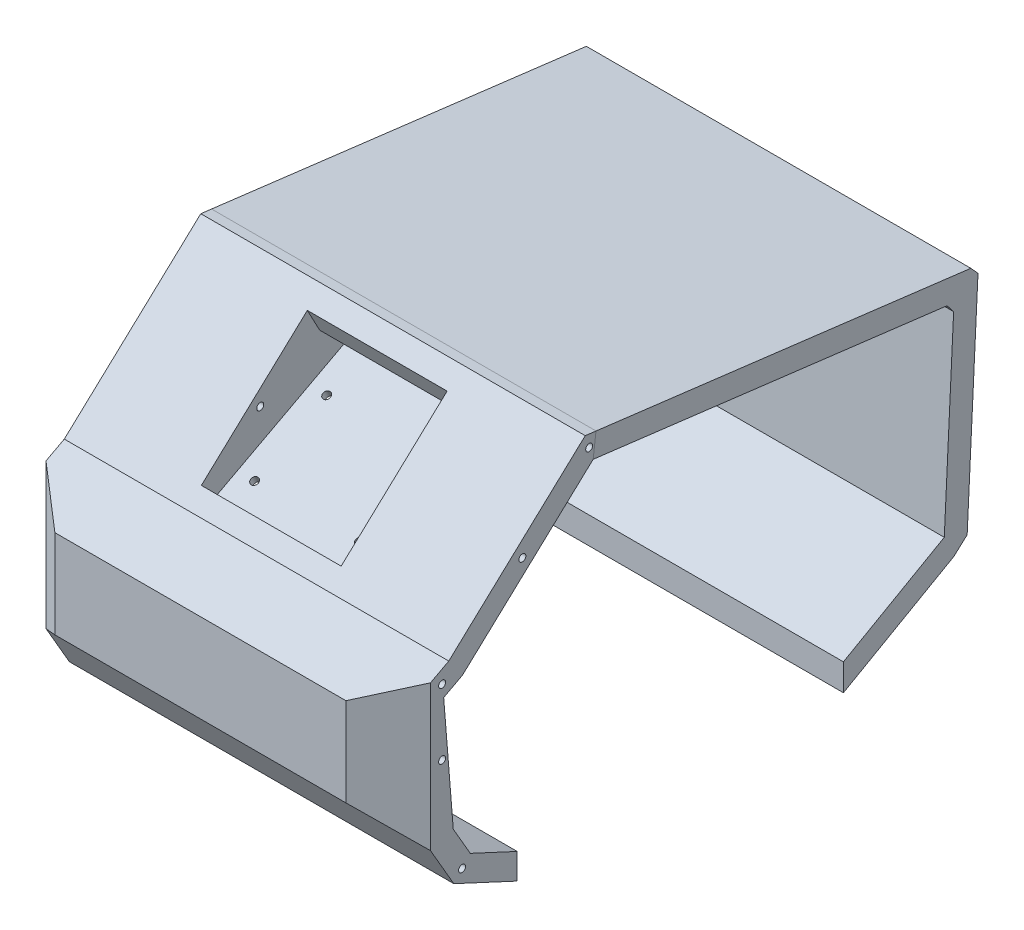
from build123d import *

# Parameters (mm, degrees)
EXTRUDE_1_DEPTH          = 165
CHAMFER_START            = -1
CHAMFER_2_DEPTH          = 167
CHAMFER_2_2_DEPTH        = 165
CHAMFER_3_SIZE           = 2
CHAMFER_3_SIZE2          = 6.502897882
EXTRUDE_2_DEPTH          = 165
CUT_EXTRUDE_1_DEPTH      = 129
CUT_EXTRUDE_1_DEPTH_BACK = 90
SKETCH_19_R              = 1.5
CUT_EXTRUDE_4_DEPTH      = 359
EXTRUDE_5_REACH          = 253.104
SKETCH_25_W              = 60
SKETCH_25_H              = 60
CUT_EXTRUDE_6_DEPTH      = 68
EXTRUDE_6_REACH          = 275.755
SKETCH_26_W              = 60
SKETCH_26_H              = 3
SKETCH_27_R              = 1.6
CUT_EXTRUDE_7_DEPTH      = 68
SKETCH_28_W              = 70
SKETCH_28_H              = 14
CUT_EXTRUDE_8_DEPTH      = 5
SKETCH_29_W              = 5
SKETCH_29_H              = 14
EXTRUDE_7_DEPTH          = 5


with BuildPart() as part:
    # 草图1 → 凸台-拉伸1 (new body)
    with BuildSketch(Plane(origin=(0, 0, 0), x_dir=(0, 0, -1), z_dir=(1, 0, 0))):
        Polygon((-119.14227599, 9.392327421), (-63.016495383, 61.600065372), (91.851255652, 42.389083929), (87.677118577, -42.733366558), (44.389827178, -67.355869721), (44.389827178, -78.860441079), (97.396076824, -48.709639137), (102.293876984, 51.170346614), (-66.413062293, 72.098046913), (-124.989193473, 17.611013079), (-137.666400315, 10.890640602), (-132.842708295, -48.915145032), (-122.817695194, -66.221187685), (-95.610172822, -78.860441079), (-95.610172822, -67.834078741), (-115.745111112, -58.48039399), (-123.056782297, -45.858356282), (-127.169844392, 5.136796181), align=None)
    extrude(amount=EXTRUDE_1_DEPTH)

    # 倒角2: read off the stored shape, not the designer's step
    # 倒角2 outline → 倒角2 (cut)
    with BuildSketch(Plane.YZ.offset(CHAMFER_START)):
        Polygon((51.170346614, -102.293876984), (51.570519841, -99.067913343), (48.173947041, -102.146942979), align=None)
    extrude(amount=CHAMFER_2_DEPTH, mode=Mode.SUBTRACT)

    # Chamfer 2 2 outline → Chamfer 2 2 (add)
    with BuildSketch(Plane.YZ):
        Polygon((42.389083929, -91.851255652), (42.758396287, -88.874074371), (39.142296059, -91.692043393), align=None)
    extrude(amount=CHAMFER_2_2_DEPTH)

    # 倒角3
    chamfer_3_edges = [part.edges().sort_by_distance(p)[0] for p in [
        (82.5, -48.709639137, -97.396076824),
    ]]
    chamfer_3_side = [part.faces().sort_by_distance(p)[0] for p in [
        (82.5, -0.267846048, -99.771509901),
    ]]
    chamfer(chamfer_3_edges, length=CHAMFER_3_SIZE, length2=CHAMFER_3_SIZE2, reference=chamfer_3_side[0])

    # 草图12 → 凸台-拉伸2 (add)
    with BuildSketch(Plane(origin=(165, 0, 0), x_dir=(0, 0, -1), z_dir=(1, 0, 0))):
        Polygon((-149.032892218, 4.865097255), (-149.032892218, -33.12186714), (-132.842708295, -48.915145032), (-137.666400315, 10.890640602), align=None)
    extrude(amount=-EXTRUDE_2_DEPTH)

    # 草图13 → 切除-拉伸1 (cut, two sides: drawn at the far end of the back side and taken through both)
    with BuildSketch(Plane.XZ.offset(-4.865097255).offset(-CUT_EXTRUDE_1_DEPTH_BACK)):
        Polygon((0, 149.032892218), (0, 132.842708295), (20, 149.032892218), align=None)
        Polygon((144.913186348, 149.032892218), (165, 149.032892218), (165, 132.842708295), align=None)
    extrude(amount=CUT_EXTRUDE_1_DEPTH + CUT_EXTRUDE_1_DEPTH_BACK, mode=Mode.SUBTRACT)


with BuildPart() as body_2:
    # Split Bodies 1: read off the stored shape, not the designer's step
    # Split Bodies 1: the piece on the far side of the plane
    add(part.part)
    split(bisect_by=Plane(origin=(0, 8.632109926, 69.587046078), x_dir=(1, 0, 0), z_dir=(0, 0.12310411940930002, 0.9923937604522012)), keep=Keep.BOTTOM)


with BuildPart() as part_1:
    add(part.part)

    # Split Bodies 1
    split(bisect_by=Plane(origin=(0, 8.632109926, 69.587046078), x_dir=(1, 0, 0), z_dir=(0, 0.12310411940930002, 0.9923937604522012)), keep=Keep.TOP)

    # 草图19 → 切除-拉伸4 (cut)
    with BuildSketch(Plane(origin=(165, 0, 0), x_dir=(0, 0, -1), z_dir=(1, 0, 0))):
        with Locations((-127.842708295, 10.4392122)):
            Circle(SKETCH_19_R)
        with Locations((-127.842708295, -17.733697424)):
            Circle(SKETCH_19_R)
        with Locations((-119.281403153, -62.350790838)):
            Circle(SKETCH_19_R)
        with Locations((-93.392718519, 40.173073312)):
            Circle(SKETCH_19_R)
        with Locations((-64.719702306, 66.844476373)):
            Circle(SKETCH_19_R)
    extrude(amount=-CUT_EXTRUDE_4_DEPTH, mode=Mode.SUBTRACT)

    # 凸台-拉伸5: up to this plane
    extrude_5_end = Plane(origin=(165, 64.450909172, 59.951703842), z_dir=(0, -0.7322016397474544, -0.6810879229226864))
    # 草图24 → 凸台-拉伸5 (add, up to the surface)
    with BuildSketch(Plane(origin=(0, 56.635574201, 30.023344955), x_dir=(1, 0, 0), z_dir=(0, 0.8835309997249798, 0.4683726855026645)), mode=Mode.PRIVATE) as extrude_5_sk1:
        Polygon((112.5, -50.383912681), (117.5, -48.140229484), (117.5, -28.846011859), (47.5, -28.846011859), (47.5, -79.551794233), (52.5, -77.308111036), (52.5, -33.846011859), (112.5, -33.846011859), align=None)
    extrude_5_tool1 = split(extrude(extrude_5_sk1.sketch, amount=EXTRUDE_5_REACH, mode=Mode.PRIVATE), bisect_by=extrude_5_end, keep=Keep.BOTH, mode=Mode.PRIVATE)
    add(extrude_5_tool1.solids().sort_by_distance((49.646128, 20.270483, 98.621891))[0])
    # 草图24 → 凸台-拉伸5 (add, up to the surface)
    with BuildSketch(Plane(origin=(0, 56.635574201, 30.023344955), x_dir=(1, 0, 0), z_dir=(0, 0.8835309997249798, 0.4683726855026645)), mode=Mode.PRIVATE) as extrude_5_sk2:
        Polygon((117.5, -98.846011859), (117.5, -48.140229484), (112.5, -50.383912681), (112.5, -93.846011859), (52.5, -93.846011859), (52.5, -77.308111036), (47.5, -79.551794233), (47.5, -98.846011859), align=None)
    extrude_5_tool2 = split(extrude(extrude_5_sk2.sketch, amount=EXTRUDE_5_REACH, mode=Mode.PRIVATE), bisect_by=extrude_5_end, keep=Keep.BOTH, mode=Mode.PRIVATE)
    add(extrude_5_tool2.solids().sort_by_distance((48.364354, 14.857244, 108.833341))[0])

    # 草图25 → 切除-拉伸6 (cut)
    with BuildSketch(Plane(origin=(0, 56.635574201, 30.023344955), x_dir=(-1, 0, 0), z_dir=(0, -0.8835309997249798, -0.46837268550266453))):
        with Locations((-82.5, -63.846011859)):
            Rectangle(SKETCH_25_W, SKETCH_25_H)
    extrude(amount=-CUT_EXTRUDE_6_DEPTH, mode=Mode.SUBTRACT)

    # 草图26 → 凸台-拉伸6 (add, up to next)
    with BuildSketch(Plane(origin=(0, -43.954908598, 82.915860678), x_dir=(-1, 0, 0), z_dir=(0, 0.4683726855026646, -0.8835309997249798)), mode=Mode.PRIVATE) as extrude_6_sk1:
        with Locations((-82.5, 65.601400198)):
            Rectangle(SKETCH_26_W, SKETCH_26_H)
    extrude_6_tool1 = extrude(extrude_6_sk1.sketch, amount=EXTRUDE_6_REACH, mode=Mode.PRIVATE) - part_1.part
    add(extrude_6_tool1.solids().sort_by_distance((82.5, 14.005962, 113.641765))[0])

    # 草图27 → 切除-拉伸7 (cut)
    with BuildSketch(Plane(origin=(0, 59.2861672, 31.428463012), x_dir=(1, 0, 0), z_dir=(0, 0.8835309997249797, 0.46837268550266475))):
        with Locations(Location((60, -46.346011859, 0), (0, 0, 270))):
            Circle(SKETCH_27_R)
        with Locations(Location((105, -46.346011859, 0), (0, 0, 270))):
            Circle(SKETCH_27_R)
        with Locations(Location((60, -81.346011859, 0), (0, 0, 270))):
            Circle(SKETCH_27_R)
        with Locations(Location((105, -81.346011859, 0), (0, 0, 270))):
            Circle(SKETCH_27_R)
    extrude(amount=-CUT_EXTRUDE_7_DEPTH, mode=Mode.SUBTRACT)

    # 草图28 → 切除-拉伸8 (cut)
    with BuildSketch(Plane(origin=(0, -13.51068404, 25.486345695), x_dir=(-1, 0, 0), z_dir=(0, 0.4683726855026646, -0.8835309997249798))):
        with Locations((-82.5, 74.101400198)):
            Rectangle(SKETCH_28_W, SKETCH_28_H)
    extrude(amount=-CUT_EXTRUDE_8_DEPTH, mode=Mode.SUBTRACT)

    # 草图29 → 凸台-拉伸7 (add)
    with BuildSketch(Plane(origin=(0, -15.852547468, 29.904000694), x_dir=(-1, 0, 0), z_dir=(0, 0.4683726855026646, -0.8835309997249798))):
        with Locations((-115, 74.101400198)):
            Rectangle(SKETCH_29_W, SKETCH_29_H)
        with Locations((-50, 74.101400198)):
            Rectangle(SKETCH_29_W, SKETCH_29_H)
    extrude(amount=EXTRUDE_7_DEPTH)


solid = Compound([body_2.part, part_1.part])
